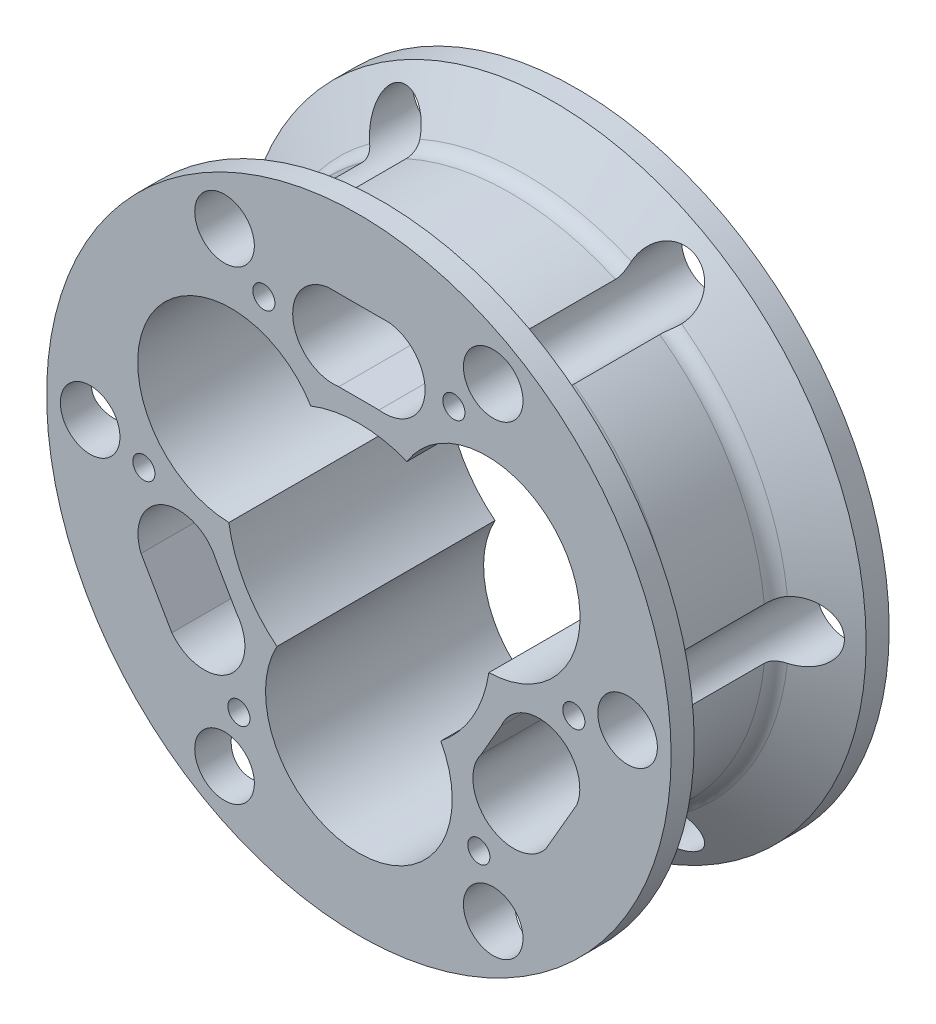
from build123d import *

# Parameters (mm, degrees)
CUT_EXTRUDE1_DEPTH         = 68.805329734
CUT_EXTRUDE2_DEPTH         = 68.805329734
CUT_EXTRUDE3_DEPTH         = 68.805329734
HOLE1_D                    = 36.195
F_31_0_12_DIAMETER_HOLE1_D = 3.048
P_0_323_DIAMETER_HOLE1_D   = 8.2042
HOLE2_D                    = 25.7048
FILLET1_R                  = 2.3622


with BuildPart() as part:
    # Sketch1 → Revolve1 (revolve)
    with BuildSketch(Plane(origin=(0, 0, 0), x_dir=(1, 0, 0), z_dir=(0, 1, 0))):
        Polygon((42.9895, 30.0228), (0, 30.0228), (0, 0), (42.9895, 0), (42.9895, 3.175), (35.0774, 7.743053065), (35.0774, 22.279746935), (42.9895, 26.8478), align=None)
    revolve(axis=Axis((0, 0, -30.0228), (0, 0, 1)))

    # Sketch2 → Cut-Extrude1 (cut, through all)
    with BuildSketch(Plane.XY):
        with BuildLine():
            Line((25.751849166, -19.760088855), (29.988663513, -12.421711145))
            ThreePointArc((29.988663513, -12.421711145), (26.953962093, -5.095293818), (19.627544766, -8.129995238))
            Line((19.627544766, -8.129995238), (16.854554792, -12.932954762))
            ThreePointArc((16.854554792, -12.932954762), (17.889634932, -20.795168996), (25.751849166, -19.760088855))
        make_face()
    extrude(amount=-CUT_EXTRUDE1_DEPTH, mode=Mode.SUBTRACT)

    # Sketch3 → Cut-Extrude2 (cut, through all)
    with BuildSketch(Plane.XY):
        with BuildLine():
            Line((-29.988663513, -12.421711145), (-25.751849166, -19.760088855))
            ThreePointArc((-25.751849166, -19.760088855), (-17.889634932, -20.795168996), (-16.854554792, -12.932954762))
            Line((-16.854554792, -12.932954762), (-19.627544766, -8.129995238))
            ThreePointArc((-19.627544766, -8.129995238), (-26.953962093, -5.095293818), (-29.988663513, -12.421711145))
        make_face()
    extrude(amount=-CUT_EXTRUDE2_DEPTH, mode=Mode.SUBTRACT)

    # Sketch4 → Cut-Extrude3 (cut, through all)
    with BuildSketch(Plane(origin=(0, 0, -30.0228), x_dir=(-1, 0, 0), z_dir=(0, 0, -1))):
        with BuildLine():
            Line((-2.772989974, 21.06295), (2.772989974, 21.06295))
            ThreePointArc((2.772989974, 21.06295), (9.06432716, 25.890462814), (4.236814347, 32.1818))
            Line((4.236814347, 32.1818), (-4.236814347, 32.1818))
            ThreePointArc((-4.236814347, 32.1818), (-9.06432716, 25.890462814), (-2.772989974, 21.06295))
        make_face()
    extrude(amount=-CUT_EXTRUDE3_DEPTH, mode=Mode.SUBTRACT)

    # Hole1 (through all)
    with Locations(Plane(origin=(0, 0, -30.0228), x_dir=(-1, 0, 0), z_dir=(0, 0, -1))):
        with Locations((0, 0)):
            Hole(HOLE1_D / 2)

    # #31 (0.12) Diameter Hole1 (through all)
    with Locations(Plane.XY):
        with Locations((13.081228584, 26.622375), (-13.081228584, 26.622375), (-29.596267351, -1.982511233), (-16.515038767, -24.639863767), (16.515038767, -24.639863767), (29.596267351, -1.982511233)):
            Hole(F_31_0_12_DIAMETER_HOLE1_D / 2)

    # P (0.323) Diameter Hole1 (through all)
    with Locations(Plane(origin=(0, 0, -30.0228), x_dir=(-1, 0, 0), z_dir=(0, 0, -1))):
        with Locations((-36.9951, 0), (-18.49755, 32.038696416), (18.49755, 32.038696416), (36.9951, 0), (18.49755, -32.038696416), (-18.49755, -32.038696416)):
            Hole(P_0_323_DIAMETER_HOLE1_D / 2)

    # Hole2 (through all)
    with Locations(Plane(origin=(0, 0, -30.0228), x_dir=(-1, 0, 0), z_dir=(0, 0, -1))):
        with Locations((0, -20.32), (17.597636205, 10.16), (-17.597636205, 10.16)):
            Hole(HOLE2_D / 2)

    # Fillet1
    # the kernel refuses this fillet: 2.3622 mm, written as the material it adds along each edge
    with BuildSketch(Plane(origin=(0, 0, -22.279746935), x_dir=(-0.5030228628819422, 0.8642731046480937, 0), z_dir=(0.8642731046480937, 0.5030228628819422, 0))) as fillet1_piece_1_section:
        with BuildLine():
            CenterArc((35.0774 + FILLET1_R, FILLET1_R * 0.57735026919), FILLET1_R, 180, 60)
            Line((35.0774, FILLET1_R * 0.57735026919), (35.0774, 0))
            Line((35.0774, 0), (35.0774 + FILLET1_R * 0.5, -FILLET1_R * 0.288675134595))
        make_face()
    fillet1_piece_1 = revolve(axis=Axis((0, 0, -22.279746935), (0, 0, 1)), revolution_arc=59.599613342, mode=Mode.PRIVATE)
    fillet1_piece_1 = fillet1_piece_1 - Plane(origin=(-36.9951, 0, -22.108716792), x_dir=(1, 0, 0), z_dir=(0, 0, 1)) * Cylinder(4.1021, 146, mode=Mode.PRIVATE)
    fillet1_piece_1 = fillet1_piece_1 - Plane(origin=(-18.49755, 32.038696416, -22.108716792), x_dir=(1, 0, 0), z_dir=(0, 0, 1)) * Cylinder(4.1021, 146, mode=Mode.PRIVATE)
    add(fillet1_piece_1)
    with BuildSketch(Plane(origin=(0, 0, -22.279746935), x_dir=(0.9999938958738231, 0.0034940256285524883, 0), z_dir=(0.0034940256285524883, -0.9999938958738231, 0))) as fillet1_piece_2_section:
        with BuildLine():
            CenterArc((35.0774 + FILLET1_R, FILLET1_R * 0.57735026919), FILLET1_R, 180, 60)
            Line((35.0774, FILLET1_R * 0.57735026919), (35.0774, 0))
            Line((35.0774, 0), (35.0774 + FILLET1_R * 0.5, -FILLET1_R * 0.288675134595))
        make_face()
    fillet1_piece_2 = revolve(axis=Axis((0, 0, -22.279746935), (0, 0, 1)), revolution_arc=59.599613342, mode=Mode.PRIVATE)
    fillet1_piece_2 = fillet1_piece_2 - Plane(origin=(18.49755, 32.038696416, -22.108716793), x_dir=(1, 0, 0), z_dir=(0, 0, 1)) * Cylinder(4.1021, 146, mode=Mode.PRIVATE)
    fillet1_piece_2 = fillet1_piece_2 - Plane(origin=(36.9951, 0, -22.108716793), x_dir=(1, 0, 0), z_dir=(0, 0, 1)) * Cylinder(4.1021, 146, mode=Mode.PRIVATE)
    add(fillet1_piece_2)
    with BuildSketch(Plane(origin=(0, 0, -22.279746935), x_dir=(0.4969710329812678, 0.8677671302702883, 0), z_dir=(0.8677671302702883, -0.4969710329812678, 0))) as fillet1_piece_3_section:
        with BuildLine():
            CenterArc((35.0774 + FILLET1_R, FILLET1_R * 0.57735026919), FILLET1_R, 180, 60)
            Line((35.0774 + FILLET1_R * 0.5, -FILLET1_R * 0.288675134595), (35.0774, 0))
            Line((35.0774, 0), (35.0774, FILLET1_R * 0.57735026919))
        make_face()
    fillet1_piece_3 = revolve(axis=Axis((0, 0, -22.279746935), (0, 0, 1)), revolution_arc=59.599613341, mode=Mode.PRIVATE)
    fillet1_piece_3 = fillet1_piece_3 - Plane(origin=(18.49755, 32.038696416, -22.108716799), x_dir=(1, 0, 0), z_dir=(0, 0, 1)) * Cylinder(4.1021, 146, mode=Mode.PRIVATE)
    fillet1_piece_3 = fillet1_piece_3 - Plane(origin=(-18.49755, 32.038696416, -22.108716799), x_dir=(1, 0, 0), z_dir=(0, 0, 1)) * Cylinder(4.1021, 146, mode=Mode.PRIVATE)
    add(fillet1_piece_3)
    with BuildSketch(Plane(origin=(0, 0, -22.279746935), x_dir=(0.5030228628819429, -0.8642731046480934, 0), z_dir=(-0.8642731046480934, -0.5030228628819429, 0))) as fillet1_piece_4_section:
        with BuildLine():
            CenterArc((35.0774 + FILLET1_R, FILLET1_R * 0.57735026919), FILLET1_R, 180, 60)
            Line((35.0774, FILLET1_R * 0.57735026919), (35.0774, 0))
            Line((35.0774, 0), (35.0774 + FILLET1_R * 0.5, -FILLET1_R * 0.288675134595))
        make_face()
    fillet1_piece_4 = revolve(axis=Axis((0, 0, -22.279746935), (0, 0, 1)), revolution_arc=59.599613342, mode=Mode.PRIVATE)
    fillet1_piece_4 = fillet1_piece_4 - Plane(origin=(36.9951, 0, -22.108716792), x_dir=(1, 0, 0), z_dir=(0, 0, 1)) * Cylinder(4.1021, 146, mode=Mode.PRIVATE)
    fillet1_piece_4 = fillet1_piece_4 - Plane(origin=(18.49755, -32.038696416, -22.108716792), x_dir=(1, 0, 0), z_dir=(0, 0, 1)) * Cylinder(4.1021, 146, mode=Mode.PRIVATE)
    add(fillet1_piece_4)
    with BuildSketch(Plane(origin=(0, 0, -7.743053065), x_dir=(-0.5030228628819449, 0.8642731046480921, 0), z_dir=(0.8642731046480921, 0.5030228628819449, 0))) as fillet1_piece_5_section:
        with BuildLine():
            CenterArc((35.0774 + FILLET1_R, -FILLET1_R * 0.57735026919), FILLET1_R, 120, 60)
            Line((35.0774 + FILLET1_R * 0.5, FILLET1_R * 0.288675134595), (35.0774, 0))
            Line((35.0774, 0), (35.0774, -FILLET1_R * 0.57735026919))
        make_face()
    fillet1_piece_5 = revolve(axis=Axis((0, 0, -7.743053065), (0, 0, 1)), revolution_arc=59.599613342, mode=Mode.PRIVATE)
    fillet1_piece_5 = fillet1_piece_5 - Plane(origin=(-18.49755, 32.038696416, -7.914083207), x_dir=(1, 0, 0), z_dir=(0, 0, 1)) * Cylinder(4.1021, 146, mode=Mode.PRIVATE)
    fillet1_piece_5 = fillet1_piece_5 - Plane(origin=(-36.9951, 0, -7.914083207), x_dir=(1, 0, 0), z_dir=(0, 0, 1)) * Cylinder(4.1021, 146, mode=Mode.PRIVATE)
    add(fillet1_piece_5)
    with BuildSketch(Plane(origin=(0, 0, -7.743053065), x_dir=(-0.496971032981266, -0.8677671302702894, 0), z_dir=(-0.8677671302702894, 0.496971032981266, 0))) as fillet1_piece_6_section:
        with BuildLine():
            CenterArc((35.0774 + FILLET1_R, -FILLET1_R * 0.57735026919), FILLET1_R, 120, 60)
            Line((35.0774 + FILLET1_R * 0.5, FILLET1_R * 0.288675134595), (35.0774, 0))
            Line((35.0774, 0), (35.0774, -FILLET1_R * 0.57735026919))
        make_face()
    fillet1_piece_6 = revolve(axis=Axis((0, 0, -7.743053065), (0, 0, 1)), revolution_arc=59.599613341, mode=Mode.PRIVATE)
    fillet1_piece_6 = fillet1_piece_6 - Plane(origin=(-18.49755, -32.038696416, -7.914083208), x_dir=(1, 0, 0), z_dir=(0, 0, 1)) * Cylinder(4.1021, 146, mode=Mode.PRIVATE)
    fillet1_piece_6 = fillet1_piece_6 - Plane(origin=(18.49755, -32.038696416, -7.914083208), x_dir=(1, 0, 0), z_dir=(0, 0, 1)) * Cylinder(4.1021, 146, mode=Mode.PRIVATE)
    add(fillet1_piece_6)
    with BuildSketch(Plane(origin=(0, 0, -7.743053065), x_dir=(0.4969710329812654, 0.8677671302702897, 0), z_dir=(0.8677671302702897, -0.4969710329812654, 0))) as fillet1_piece_7_section:
        with BuildLine():
            CenterArc((35.0774 + FILLET1_R, -FILLET1_R * 0.57735026919), FILLET1_R, 120, 60)
            Line((35.0774 + FILLET1_R * 0.5, FILLET1_R * 0.288675134595), (35.0774, 0))
            Line((35.0774, 0), (35.0774, -FILLET1_R * 0.57735026919))
        make_face()
    fillet1_piece_7 = revolve(axis=Axis((0, 0, -7.743053065), (0, 0, 1)), revolution_arc=59.599613341, mode=Mode.PRIVATE)
    fillet1_piece_7 = fillet1_piece_7 - Plane(origin=(18.49755, 32.038696416, -7.914083201), x_dir=(1, 0, 0), z_dir=(0, 0, 1)) * Cylinder(4.1021, 146, mode=Mode.PRIVATE)
    fillet1_piece_7 = fillet1_piece_7 - Plane(origin=(-18.49755, 32.038696416, -7.914083201), x_dir=(1, 0, 0), z_dir=(0, 0, 1)) * Cylinder(4.1021, 146, mode=Mode.PRIVATE)
    add(fillet1_piece_7)
    with BuildSketch(Plane(origin=(0, 0, -22.279746935), x_dir=(-0.49697103298126766, -0.8677671302702885, 0), z_dir=(-0.8677671302702885, 0.49697103298126766, 0))) as fillet1_piece_8_section:
        with BuildLine():
            CenterArc((35.0774 + FILLET1_R, FILLET1_R * 0.57735026919), FILLET1_R, 180, 60)
            Line((35.0774, FILLET1_R * 0.57735026919), (35.0774, 0))
            Line((35.0774, 0), (35.0774 + FILLET1_R * 0.5, -FILLET1_R * 0.288675134595))
        make_face()
    fillet1_piece_8 = revolve(axis=Axis((0, 0, -22.279746935), (0, 0, 1)), revolution_arc=59.599613341, mode=Mode.PRIVATE)
    fillet1_piece_8 = fillet1_piece_8 - Plane(origin=(18.49755, -32.038696416, -22.108716792), x_dir=(1, 0, 0), z_dir=(0, 0, 1)) * Cylinder(4.1021, 146, mode=Mode.PRIVATE)
    fillet1_piece_8 = fillet1_piece_8 - Plane(origin=(-18.49755, -32.038696416, -22.108716792), x_dir=(1, 0, 0), z_dir=(0, 0, 1)) * Cylinder(4.1021, 146, mode=Mode.PRIVATE)
    add(fillet1_piece_8)
    with BuildSketch(Plane(origin=(0, 0, -7.743053065), x_dir=(0.9999938958738231, 0.0034940256285532793, 0), z_dir=(0.0034940256285532793, -0.9999938958738231, 0))) as fillet1_piece_9_section:
        with BuildLine():
            CenterArc((35.0774 + FILLET1_R, -FILLET1_R * 0.57735026919), FILLET1_R, 120, 60)
            Line((35.0774 + FILLET1_R * 0.5, FILLET1_R * 0.288675134595), (35.0774, 0))
            Line((35.0774, 0), (35.0774, -FILLET1_R * 0.57735026919))
        make_face()
    fillet1_piece_9 = revolve(axis=Axis((0, 0, -7.743053065), (0, 0, 1)), revolution_arc=59.599613342, mode=Mode.PRIVATE)
    fillet1_piece_9 = fillet1_piece_9 - Plane(origin=(18.49755, 32.038696416, -7.914083207), x_dir=(1, 0, 0), z_dir=(0, 0, 1)) * Cylinder(4.1021, 146, mode=Mode.PRIVATE)
    fillet1_piece_9 = fillet1_piece_9 - Plane(origin=(36.9951, 0, -7.914083207), x_dir=(1, 0, 0), z_dir=(0, 0, 1)) * Cylinder(4.1021, 146, mode=Mode.PRIVATE)
    add(fillet1_piece_9)
    with BuildSketch(Plane(origin=(0, 0, -7.743053065), x_dir=(-0.9999938958738231, -0.003494025628553032, 0), z_dir=(-0.003494025628553032, 0.9999938958738231, 0))) as fillet1_piece_10_section:
        with BuildLine():
            CenterArc((35.0774 + FILLET1_R, -FILLET1_R * 0.57735026919), FILLET1_R, 120, 60)
            Line((35.0774 + FILLET1_R * 0.5, FILLET1_R * 0.288675134595), (35.0774, 0))
            Line((35.0774, 0), (35.0774, -FILLET1_R * 0.57735026919))
        make_face()
    fillet1_piece_10 = revolve(axis=Axis((0, 0, -7.743053065), (0, 0, 1)), revolution_arc=59.599613342, mode=Mode.PRIVATE)
    fillet1_piece_10 = fillet1_piece_10 - Plane(origin=(-36.9951, 0, -7.914083208), x_dir=(1, 0, 0), z_dir=(0, 0, 1)) * Cylinder(4.1021, 146, mode=Mode.PRIVATE)
    fillet1_piece_10 = fillet1_piece_10 - Plane(origin=(-18.49755, -32.038696416, -7.914083208), x_dir=(1, 0, 0), z_dir=(0, 0, 1)) * Cylinder(4.1021, 146, mode=Mode.PRIVATE)
    add(fillet1_piece_10)
    with BuildSketch(Plane(origin=(0, 0, -7.743053065), x_dir=(0.5030228628819444, -0.8642731046480925, 0), z_dir=(-0.8642731046480925, -0.5030228628819444, 0))) as fillet1_piece_11_section:
        with BuildLine():
            CenterArc((35.0774 + FILLET1_R, -FILLET1_R * 0.57735026919), FILLET1_R, 120, 60)
            Line((35.0774 + FILLET1_R * 0.5, FILLET1_R * 0.288675134595), (35.0774, 0))
            Line((35.0774, 0), (35.0774, -FILLET1_R * 0.57735026919))
        make_face()
    fillet1_piece_11 = revolve(axis=Axis((0, 0, -7.743053065), (0, 0, 1)), revolution_arc=59.599613342, mode=Mode.PRIVATE)
    fillet1_piece_11 = fillet1_piece_11 - Plane(origin=(18.49755, -32.038696416, -7.914083207), x_dir=(1, 0, 0), z_dir=(0, 0, 1)) * Cylinder(4.1021, 146, mode=Mode.PRIVATE)
    fillet1_piece_11 = fillet1_piece_11 - Plane(origin=(36.9951, 0, -7.914083207), x_dir=(1, 0, 0), z_dir=(0, 0, 1)) * Cylinder(4.1021, 146, mode=Mode.PRIVATE)
    add(fillet1_piece_11)
    with BuildSketch(Plane(origin=(0, 0, -22.279746935), x_dir=(-0.9999938958738231, -0.0034940256285521444, 0), z_dir=(-0.0034940256285521444, 0.9999938958738231, 0))) as fillet1_piece_12_section:
        with BuildLine():
            CenterArc((35.0774 + FILLET1_R, FILLET1_R * 0.57735026919), FILLET1_R, 180, 60)
            Line((35.0774, FILLET1_R * 0.57735026919), (35.0774, 0))
            Line((35.0774, 0), (35.0774 + FILLET1_R * 0.5, -FILLET1_R * 0.288675134595))
        make_face()
    fillet1_piece_12 = revolve(axis=Axis((0, 0, -22.279746935), (0, 0, 1)), revolution_arc=59.599613342, mode=Mode.PRIVATE)
    fillet1_piece_12 = fillet1_piece_12 - Plane(origin=(-18.49755, -32.038696416, -22.108716792), x_dir=(1, 0, 0), z_dir=(0, 0, 1)) * Cylinder(4.1021, 146, mode=Mode.PRIVATE)
    fillet1_piece_12 = fillet1_piece_12 - Plane(origin=(-36.9951, 0, -22.108716792), x_dir=(1, 0, 0), z_dir=(0, 0, 1)) * Cylinder(4.1021, 146, mode=Mode.PRIVATE)
    add(fillet1_piece_12)


solid = part.part
